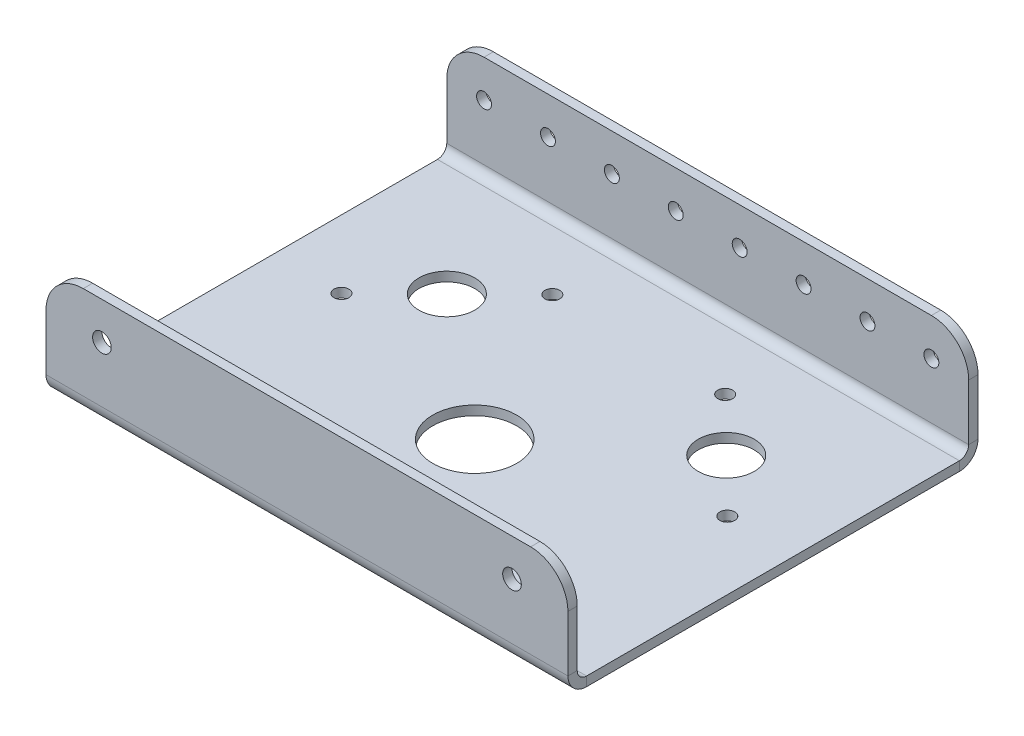
from build123d import *

# Parameters (mm, degrees)
SKETCH1_W           = 177.8
SKETCH1_H           = 127
BOSS_EXTRUDE1_DEPTH = 3.175
EDGE_FLANGE1_DEPTH  = 177.8
EDGE_FLANGE2_DEPTH  = 177.8
SKETCH17_R          = 2.54
CUT_EXTRUDE1_DEPTH  = 5.08
FILLET1_R           = 12.7
SKETCH18_R          = 3.175
CUT_EXTRUDE2_DEPTH  = 5.08
SKETCH19_R          = 14.2875
CUT_EXTRUDE3_DEPTH  = 12.7
SKETCH20_R          = 9.525
CUT_EXTRUDE4_DEPTH  = 12.7
SKETCH21_R          = 2.54
CUT_EXTRUDE6_DEPTH  = 12.7


# Sheet-metal steps are written as plain solids
with BuildPart() as part:
    # Sketch1 → Boss-Extrude1 (new body)
    with BuildSketch(Plane(origin=(0, 0, 0), x_dir=(1, 0, 0), z_dir=(0, 1, 0))):
        Rectangle(SKETCH1_W, SKETCH1_H)
    extrude(amount=BOSS_EXTRUDE1_DEPTH)

    # Edge-Flange1 section (across the edge) → Edge-Flange1 (add)
    with BuildSketch(Plane(origin=(88.9, 3.175, -66.675), x_dir=(0, 0, 1), z_dir=(-1, 0, 0))):
        with BuildLine():
            Line((-3.175, 3.175), (-3.175, 34.925))
            Line((-3.175, 34.925), (0, 34.925))
            Line((0, 34.925), (0, 3.175))
            ThreePointArc((0, 3.175), (0.92993597, 0.92993597), (3.175, 0))
            Line((3.175, 0), (3.175, -3.175))
            ThreePointArc((3.175, -3.175), (-1.315128061, -1.315128061), (-3.175, 3.175))
        make_face()
    extrude(amount=EDGE_FLANGE1_DEPTH)

    # Edge-Flange2 section (across the edge) → Edge-Flange2 (add)
    with BuildSketch(Plane(origin=(-88.9, 3.175, 66.675), x_dir=(0, 0, -1), z_dir=(1, 0, 0))):
        with BuildLine():
            Line((-3.175, 3.175), (-3.175, 34.925))
            Line((-3.175, 34.925), (0, 34.925))
            Line((0, 34.925), (0, 3.175))
            ThreePointArc((0, 3.175), (0.92993597, 0.92993597), (3.175, 0))
            Line((3.175, 0), (3.175, -3.175))
            ThreePointArc((3.175, -3.175), (-1.315128061, -1.315128061), (-3.175, 3.175))
        make_face()
    extrude(amount=EDGE_FLANGE2_DEPTH)

    # Sketch17 → Cut-Extrude1 (cut)
    with BuildSketch(Plane(origin=(0, 0, -69.85), x_dir=(-1, 0, 0), z_dir=(0, 0, -1))):
        with Locations(Location((-76.2, 25.4, 0), (0, 0, 90))):
            Circle(SKETCH17_R)
        with Locations(Location((-54.428571429, 25.4, 0), (0, 0, 90))):
            Circle(SKETCH17_R)
        with Locations(Location((-32.657142857, 25.4, 0), (0, 0, 90))):
            Circle(SKETCH17_R)
        with Locations(Location((-10.885714286, 25.4, 0), (0, 0, 90))):
            Circle(SKETCH17_R)
        with Locations(Location((10.885714286, 25.4, 0), (0, 0, 90))):
            Circle(SKETCH17_R)
        with Locations(Location((32.657142857, 25.4, 0), (0, 0, 90))):
            Circle(SKETCH17_R)
        with Locations(Location((54.428571429, 25.4, 0), (0, 0, 90))):
            Circle(SKETCH17_R)
        with Locations(Location((76.2, 25.4, 0), (0, 0, 90))):
            Circle(SKETCH17_R)
    extrude(amount=-CUT_EXTRUDE1_DEPTH, mode=Mode.SUBTRACT)

    # Fillet1
    fillet1_edges = [part.edges().sort_by_distance(p)[0] for p in [
        (88.9, 38.1, -68.2625),
        (-88.9, 38.1, -68.2625),
        (-88.9, 38.1, 68.2625),
        (88.9, 38.1, 68.2625),
    ]]
    fillet(fillet1_edges, radius=FILLET1_R)

    # Sketch18 → Cut-Extrude2 (cut)
    with BuildSketch(Plane(origin=(0, 0, 66.675), x_dir=(-1, 0, 0), z_dir=(0, 0, -1))):
        with Locations((69.85, 25.4)):
            Circle(SKETCH18_R)
        with Locations((-69.85, 25.4)):
            Circle(SKETCH18_R)
    extrude(amount=-CUT_EXTRUDE2_DEPTH, mode=Mode.SUBTRACT)

    # Sketch19 → Cut-Extrude3 (cut)
    with BuildSketch(Plane(origin=(0, 0, 0), x_dir=(-1, 0, 0), z_dir=(0, -1, 0))):
        with Locations(Location((0, -12.7, 0), (0, 0, 90))):
            Circle(SKETCH19_R)
    extrude(amount=-CUT_EXTRUDE3_DEPTH, mode=Mode.SUBTRACT)

    # Sketch20 → Cut-Extrude4 (cut)
    with BuildSketch(Plane.XZ):
        with Locations(Location((47.586884748, -25.4, 0), (0, 0, 270))):
            Circle(SKETCH20_R)
        with Locations(Location((-47.586884748, -25.4, 0), (0, 0, 270))):
            Circle(SKETCH20_R)
    extrude(amount=-CUT_EXTRUDE4_DEPTH, mode=Mode.SUBTRACT)

    # Sketch21 → Cut-Extrude6 (cut)
    with BuildSketch(Plane(origin=(0, 0, 0), x_dir=(-1, 0, 0), z_dir=(0, -1, 0))):
        with Locations(Location((-65.726112956, 7.62, 0), (0, 0, 90))):
            Circle(SKETCH21_R)
        with Locations(Location((-29.447656539, 43.18, 0), (0, 0, 90))):
            Circle(SKETCH21_R)
        with Locations(Location((65.726112956, 7.62, 0), (0, 0, 90))):
            Circle(SKETCH21_R)
        with Locations(Location((29.447656539, 43.18, 0), (0, 0, 90))):
            Circle(SKETCH21_R)
    extrude(amount=-CUT_EXTRUDE6_DEPTH, mode=Mode.SUBTRACT)


solid = part.part
